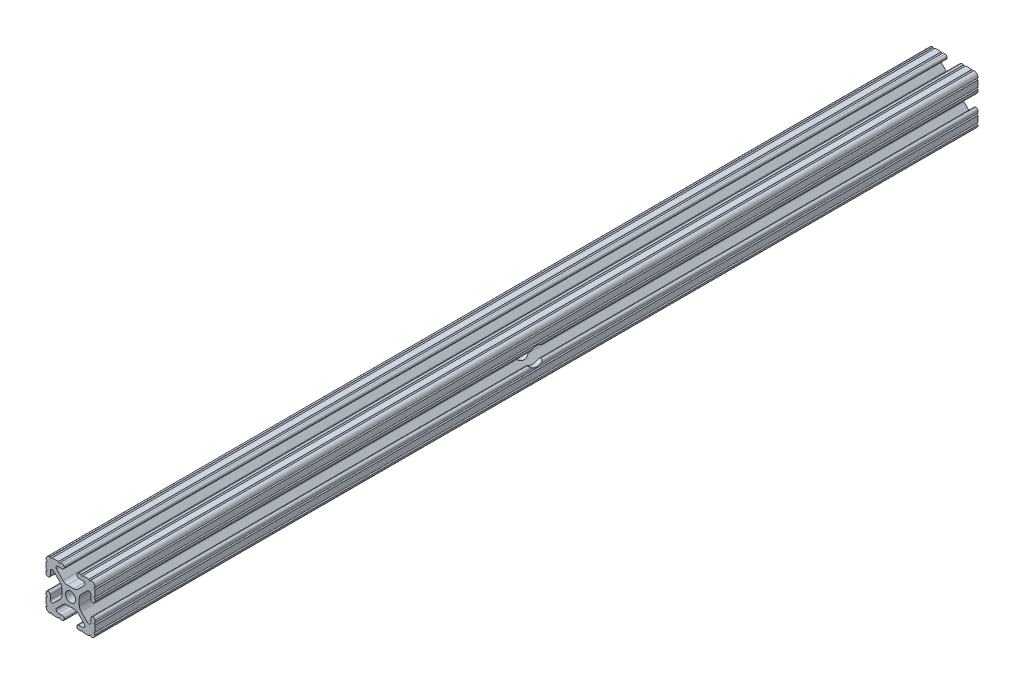
from build123d import *

# Parameters (mm, degrees)
SKETCH1_R           = 2.6035
BOSS_EXTRUDE1_DEPTH = 228.6
SKETCH2_R           = 4.7625
CUT_EXTRUDE1_DEPTH  = 231.35713577


with BuildPart() as part:
    # Sketch1 → Boss-Extrude1 (new, symmetric)
    with BuildSketch(Plane.XY):
        with BuildLine():
            Line((-7.179650497, -8.645192506), (-3.952270251, -5.423690499))
            ThreePointArc((-3.952270251, -5.423690499), (-2.922936451, -4.736929036), (-1.709253557, -4.4958))
            Line((-1.709253557, -4.4958), (1.709253557, -4.4958))
            ThreePointArc((1.709253557, -4.4958), (2.922936451, -4.736929036), (3.952270251, -5.423690499))
            Line((3.952270251, -5.423690499), (7.179650497, -8.645192506))
            ThreePointArc((7.179650497, -8.645192506), (7.41473083, -9.822813117), (6.416408329, -10.4902))
            Line((6.416408329, -10.4902), (4.287512407, -10.4902))
            ThreePointArc((4.287512407, -10.4902), (3.54574862, -10.79744862), (3.2385, -11.539212407))
            Line((3.2385, -11.539212407), (3.2385, -11.650987593))
            ThreePointArc((3.2385, -11.650987593), (3.54574862, -12.39275138), (4.287512407, -12.7))
            Line((4.287512407, -12.7), (5.317126718, -12.7))
            ThreePointArc((5.317126718, -12.7), (5.825126718, -12.192), (6.333126718, -12.7))
            Line((6.333126718, -12.7), (9.550443118, -12.7))
            ThreePointArc((9.550443118, -12.7), (10.058366869, -12.192000006), (10.566443095, -12.699847501))
            ThreePointArc((10.566443095, -12.699847501), (12.082537762, -12.08250727), (12.699846982, -10.566399977))
            ThreePointArc((12.699846982, -10.566399977), (12.192000006, -10.058323491), (12.7, -9.5504))
            Line((12.7, -9.5504), (12.7, -6.3330836))
            ThreePointArc((12.7, -6.3330836), (12.192, -5.8250836), (12.7, -5.3170836))
            Line((12.7, -5.3170836), (12.7, -4.287469289))
            ThreePointArc((12.7, -4.287469289), (12.39275138, -3.545705502), (11.650987593, -3.238456882))
            Line((11.650987593, -3.238456882), (11.539212407, -3.238456882))
            ThreePointArc((11.539212407, -3.238456882), (10.79744862, -3.545705502), (10.4902, -4.287469289))
            Line((10.4902, -4.287469289), (10.4902, -6.402089023))
            ThreePointArc((10.4902, -6.402089023), (9.856505071, -7.351067942), (8.737131347, -7.129408934))
            Line((8.737131347, -7.129408934), (5.441005833, -3.840816462))
            ThreePointArc((5.441005833, -3.840816462), (4.750877967, -2.809883091), (4.5085, -1.593185507))
            Line((4.5085, -1.593185507), (4.5085, 1.593185507))
            ThreePointArc((4.5085, 1.593185507), (4.750877967, 2.809883091), (5.441005833, 3.840816462))
            Line((5.441005833, 3.840816462), (8.737131347, 7.129408934))
            ThreePointArc((8.737131347, 7.129408934), (9.856505071, 7.351067942), (10.4902, 6.402089023))
            Line((10.4902, 6.402089023), (10.4902, 4.287469289))
            ThreePointArc((10.4902, 4.287469289), (10.79744862, 3.545705502), (11.539212407, 3.238456882))
            Line((11.539212407, 3.238456882), (11.650987593, 3.238456882))
            ThreePointArc((11.650987593, 3.238456882), (12.39275138, 3.545705502), (12.7, 4.287469289))
            Line((12.7, 4.287469289), (12.7, 5.3170836))
            ThreePointArc((12.7, 5.3170836), (12.192, 5.8250836), (12.7, 6.3330836))
            Line((12.7, 6.3330836), (12.7, 9.5504))
            ThreePointArc((12.7, 9.5504), (12.192000006, 10.058323491), (12.699846982, 10.566399977))
            ThreePointArc((12.699846982, 10.566399977), (12.082537762, 12.08250727), (10.566443095, 12.699847501))
            ThreePointArc((10.566443095, 12.699847501), (10.058366869, 12.192000006), (9.550443118, 12.7))
            Line((9.550443118, 12.7), (6.333126718, 12.7))
            ThreePointArc((6.333126718, 12.7), (5.825126718, 12.192), (5.317126718, 12.7))
            Line((5.317126718, 12.7), (4.287512407, 12.7))
            ThreePointArc((4.287512407, 12.7), (3.54574862, 12.39275138), (3.2385, 11.650987593))
            Line((3.2385, 11.650987593), (3.2385, 11.539212407))
            ThreePointArc((3.2385, 11.539212407), (3.54574862, 10.79744862), (4.287512407, 10.4902))
            Line((4.287512407, 10.4902), (6.476788598, 10.4902))
            ThreePointArc((6.476788598, 10.4902), (7.432222385, 9.85140422), (7.207036008, 8.724370562))
            Line((7.207036008, 8.724370562), (3.898272566, 5.423169045))
            ThreePointArc((3.898272566, 5.423169045), (2.869120213, 4.736787962), (1.655778399, 4.4958))
            Line((1.655778399, 4.4958), (-1.655778399, 4.4958))
            ThreePointArc((-1.655778399, 4.4958), (-2.869120213, 4.736787962), (-3.898272566, 5.423169045))
            Line((-3.898272566, 5.423169045), (-7.207036008, 8.724370562))
            ThreePointArc((-7.207036008, 8.724370562), (-7.432222385, 9.85140422), (-6.476788598, 10.4902))
            Line((-6.476788598, 10.4902), (-4.287512407, 10.4902))
            ThreePointArc((-4.287512407, 10.4902), (-3.54574862, 10.79744862), (-3.2385, 11.539212407))
            Line((-3.2385, 11.539212407), (-3.2385, 11.650987593))
            ThreePointArc((-3.2385, 11.650987593), (-3.54574862, 12.39275138), (-4.287512407, 12.7))
            Line((-4.287512407, 12.7), (-5.317126718, 12.7))
            ThreePointArc((-5.317126718, 12.7), (-5.825126718, 12.192), (-6.333126718, 12.7))
            Line((-6.333126718, 12.7), (-9.550443118, 12.7))
            ThreePointArc((-9.550443118, 12.7), (-10.058366869, 12.192000006), (-10.566443095, 12.699847501))
            ThreePointArc((-10.566443095, 12.699847501), (-12.082537762, 12.08250727), (-12.699846982, 10.566399977))
            ThreePointArc((-12.699846982, 10.566399977), (-12.192000006, 10.058323491), (-12.7, 9.5504))
            Line((-12.7, 9.5504), (-12.7, 6.3330836))
            ThreePointArc((-12.7, 6.3330836), (-12.192, 5.8250836), (-12.7, 5.3170836))
            Line((-12.7, 5.3170836), (-12.7, 4.287469289))
            ThreePointArc((-12.7, 4.287469289), (-12.39275138, 3.545705502), (-11.650987593, 3.238456882))
            Line((-11.650987593, 3.238456882), (-11.539212407, 3.238456882))
            ThreePointArc((-11.539212407, 3.238456882), (-10.79744862, 3.545705502), (-10.4902, 4.287469289))
            Line((-10.4902, 4.287469289), (-10.4902, 6.402089023))
            ThreePointArc((-10.4902, 6.402089023), (-9.856505071, 7.351067942), (-8.737131347, 7.129408934))
            Line((-8.737131347, 7.129408934), (-5.441005833, 3.840816462))
            ThreePointArc((-5.441005833, 3.840816462), (-4.750877967, 2.809883091), (-4.5085, 1.593185507))
            Line((-4.5085, 1.593185507), (-4.5085, -1.593185507))
            ThreePointArc((-4.5085, -1.593185507), (-4.750877967, -2.809883091), (-5.441005833, -3.840816462))
            Line((-5.441005833, -3.840816462), (-8.737131347, -7.129408934))
            ThreePointArc((-8.737131347, -7.129408934), (-9.856505071, -7.351067942), (-10.4902, -6.402089023))
            Line((-10.4902, -6.402089023), (-10.4902, -4.287469289))
            ThreePointArc((-10.4902, -4.287469289), (-10.79744862, -3.545705502), (-11.539212407, -3.238456882))
            Line((-11.539212407, -3.238456882), (-11.650987593, -3.238456882))
            ThreePointArc((-11.650987593, -3.238456882), (-12.39275138, -3.545705502), (-12.7, -4.287469289))
            Line((-12.7, -4.287469289), (-12.7, -5.3170836))
            ThreePointArc((-12.7, -5.3170836), (-12.192, -5.8250836), (-12.7, -6.3330836))
            Line((-12.7, -6.3330836), (-12.7, -9.5504))
            ThreePointArc((-12.7, -9.5504), (-12.192000006, -10.058323491), (-12.699846982, -10.566399977))
            ThreePointArc((-12.699846982, -10.566399977), (-12.082537762, -12.08250727), (-10.566443095, -12.699847501))
            ThreePointArc((-10.566443095, -12.699847501), (-10.058366869, -12.192000006), (-9.550443118, -12.7))
            Line((-9.550443118, -12.7), (-6.333126718, -12.7))
            ThreePointArc((-6.333126718, -12.7), (-5.825126718, -12.192), (-5.317126718, -12.7))
            Line((-5.317126718, -12.7), (-4.287512407, -12.7))
            ThreePointArc((-4.287512407, -12.7), (-3.54574862, -12.39275138), (-3.2385, -11.650987593))
            Line((-3.2385, -11.650987593), (-3.2385, -11.539212407))
            ThreePointArc((-3.2385, -11.539212407), (-3.54574862, -10.79744862), (-4.287512407, -10.4902))
            Line((-4.287512407, -10.4902), (-6.416408329, -10.4902))
            ThreePointArc((-6.416408329, -10.4902), (-7.41473083, -9.822813117), (-7.179650497, -8.645192506))
        make_face()
        Circle(SKETCH1_R, mode=Mode.SUBTRACT)
    extrude(amount=BOSS_EXTRUDE1_DEPTH, both=True)

    # Sketch2 → Cut-Extrude1 (cut, through all)
    with BuildSketch(Plane(origin=(12.7, 0, 0), x_dir=(0, 0, -1), z_dir=(1, 0, 0))):
        Circle(SKETCH2_R)
    extrude(amount=-CUT_EXTRUDE1_DEPTH, mode=Mode.SUBTRACT)


solid = part.part
